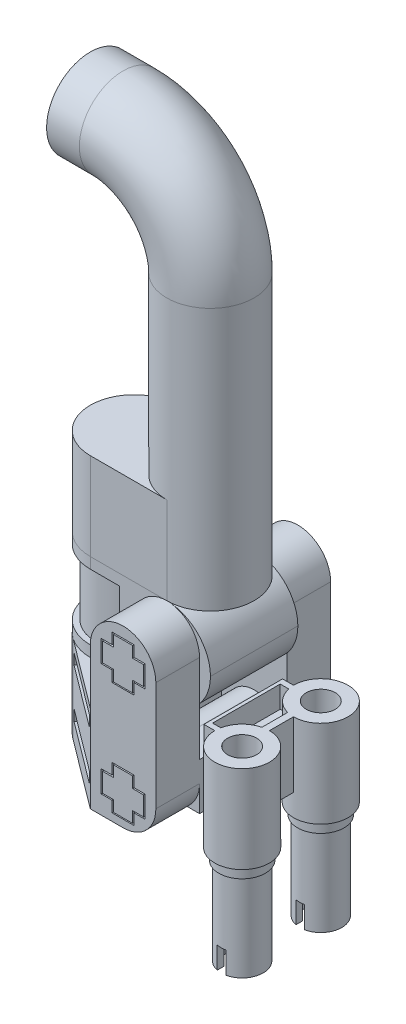
from build123d import *

# Parameters (mm, degrees)
BOSS_EXTRUDE1_DEPTH       = 8
SWEEP1_PROFILE_R          = 4
SKETCH16_R                = 2
BOSS_EXTRUDE2_DEPTH       = 8
FILLET1_R                 = 4
FILLET2_R                 = 4
CUT_EXTRUDE1_START        = -1
SKETCH19_R                = 3.5
CUT_EXTRUDE1_DEPTH        = 6
BOSS_EXTRUDE3_DEPTH       = 8
BOSS_EXTRUDE4_DEPTH       = 4
BOSS_EXTRUDE11_DEPTH      = 4
BOSS_EXTRUDE12_DEPTH      = 4
BOSS_EXTRUDE13_DEPTH      = 4
CUT_EXTRUDE3_DEPTH        = 2
CUT_EXTRUDE6_DEPTH        = 2
BOSS_EXTRUDE14_REACH      = 41.509
SKETCH33_R                = 2.466914626
BOSS_EXTRUDE16_DEPTH      = 8
BOSS_EXTRUDE17_REACH      = 41.446
BOSS_EXTRUDE17_END_RADIUS = 2.466914626
SKETCH35_W                = 8
SKETCH35_H                = 4.287776708
SKETCH36_W                = 1
SKETCH36_H                = 7.2
BOSS_EXTRUDE18_DEPTH      = 6
SKETCH37_R                = 2.499896896
BOSS_EXTRUDE19_DEPTH      = 8
BOSS_EXTRUDE19_2_DEPTH    = 8
BOSS_EXTRUDE20_DEPTH      = 6
CUT_EXTRUDE7_DEPTH        = 2
SKETCH40_R                = 2.123023315
BOSS_EXTRUDE21_DEPTH      = 1
BOSS_EXTRUDE21_2_DEPTH    = 1
SKETCH41_R                = 1.923023315
SKETCH41_R_2              = 1.323023315
BOSS_EXTRUDE22_DEPTH      = 8
BOSS_EXTRUDE22_2_DEPTH    = 8
SKETCH42_R                = 1.323023315
SKETCH42_R_2              = 1.325
CUT_EXTRUDE9_DEPTH        = 18
CUT_EXTRUDE12_DEPTH       = 2
SKETCH47_W                = 6.974811551
SKETCH47_H                = 1
CUT_EXTRUDE15_DEPTH       = 1


with BuildPart() as part:
    # Sketch1 → Boss-Extrude1 (new body)
    with BuildSketch(Plane(origin=(0, 0, 0), x_dir=(1, 0, 0), z_dir=(0, 1, 0))):
        with BuildLine():
            Line((0, -4), (-7, -4))
            ThreePointArc((-7, -4), (-11, 0), (-7, 4))
            Line((-7, 4), (0, 4))
            ThreePointArc((0, 4), (4, 0), (0, -4))
        make_face()
    extrude(amount=BOSS_EXTRUDE1_DEPTH)

    # Sweep1: sweep along a path in Sketch2
    with BuildLine(Plane.XY) as sweep1_path:
        Line((-11, 32), (-8, 32))
        ThreePointArc((-8, 32), (-2.343145751, 29.656854249), (0, 24))
        Line((0, 24), (0, 8))
    # Sweep1 profile (on start of the path) → Sweep1 (sweep)
    with BuildSketch(Plane(origin=(-11, 32, 0), x_dir=(0, 0, 1), z_dir=(1, 0, 0))):
        Circle(SWEEP1_PROFILE_R)
    sweep(path=sweep1_path.line)

    # Cut-Sweep1: sweep along a path in Sketch17
    with BuildLine(Plane.XY) as cut_sweep1_path:
        Line((0, 8), (0, 24))
        Line((0, 24), (0, 24.066611252))
        ThreePointArc((0, 24.066611252), (-2.343145751, 29.723465501), (-8, 32.066611252))
        Line((-8, 32.066611252), (-11, 32.066611252))
    # Sketch16 → Cut-Sweep1 (sweep, cut)
    with BuildSketch(Plane.ZY.offset(11)):
        with Locations((0, 32.066611252)):
            Circle(SKETCH16_R)
    sweep(path=cut_sweep1_path.line, mode=Mode.SUBTRACT)


with BuildPart() as body_2:
    # Sketch18 → Boss-Extrude2 (new body)
    with BuildSketch(Plane.XZ):
        with BuildLine():
            Line((-7, 4), (4, 4))
            Line((4, 4), (4, -4))
            Line((4, -4), (-7, -4))
            ThreePointArc((-7, -4), (-11, 0), (-7, 4))
        make_face()
    extrude(amount=BOSS_EXTRUDE2_DEPTH)

    # Fillet1
    fillet1_edges = [body_2.edges().sort_by_distance(p)[0] for p in [
        (4, -8, 0),
    ]]
    fillet(fillet1_edges, radius=FILLET1_R)

    # Fillet2
    fillet2_edges = [body_2.edges().sort_by_distance(p)[0] for p in [
        (4, 0, 0),
    ]]
    fillet(fillet2_edges, radius=FILLET2_R - 0.0001)  # a hair under: the kernel refuses the full size

    # Sketch19 → Cut-Extrude1 (cut)
    with BuildSketch(Plane.XZ.offset(8).offset(CUT_EXTRUDE1_START)):
        with BuildLine():
            Line((-2.215843823, 0.380707864), (0, 0.380707864))
            Line((0, 0.380707864), (0, -0.661102551))
            Line((0, -0.661102551), (-2.246471603, -0.661102551))
            ThreePointArc((-2.246471603, -0.661102551), (-11.797207417, 0.141031239), (-2.215843823, 0.380707864))
        make_face()
        with Locations(Location((-7, 0, 0), (0, 0, 270))):
            Circle(SKETCH19_R, mode=Mode.SUBTRACT)
    extrude(amount=-CUT_EXTRUDE1_DEPTH, mode=Mode.SUBTRACT)


with BuildPart() as body_3:
    # Sketch20 → Boss-Extrude3 (new body)
    with BuildSketch(Plane.XZ.offset(8)):
        Polygon((-3, 8), (-9.4, 3.2), (-9.4, -3.2), (-3, -8), align=None)
    extrude(amount=BOSS_EXTRUDE3_DEPTH)



with BuildPart() as body_4:
    # Sketch22 → Boss-Extrude4 (new body)
    with BuildSketch(Plane(origin=(0, 0, -4), x_dir=(-1, 0, 0), z_dir=(0, 0, -1))):
        with BuildLine():
            Line((3, -3), (3, -13))
            ThreePointArc((3, -13), (0, -16), (-3, -13))
            Line((-3, -13), (-3, -3))
            ThreePointArc((-3, -3), (0, 0), (3, -3))
        make_face()
    extrude(amount=BOSS_EXTRUDE4_DEPTH)


with BuildPart() as body_5:
    # Sketch23 → Boss-Extrude11 (new body)
    with BuildSketch(Plane.XY.offset(4)):
        with BuildLine():
            Line((3, -3), (3, -13))
            ThreePointArc((3, -13), (0, -16), (-3, -13))
            Line((-3, -13), (-3, -3))
            ThreePointArc((-3, -3), (0, 0), (3, -3))
        make_face()
    extrude(amount=BOSS_EXTRUDE11_DEPTH)


with BuildPart() as body_3_1:
    add(body_3.part)

    add(body_5.part)  # Boss-Extrude12 merges body 5
    # Sketch25 → Boss-Extrude12 (add)
    with BuildSketch(Plane.XY.offset(8)):
        with BuildLine():
            Line((0, -16), (-3, -16))
            Line((-3, -16), (-3, -13))
            ThreePointArc((-3, -13), (-2.121320344, -15.121320344), (0, -16))
        make_face()
    extrude(amount=-BOSS_EXTRUDE12_DEPTH)


    add(body_4.part)  # Boss-Extrude13 merges body 4
    # Sketch26 → Boss-Extrude13 (add)
    with BuildSketch(Plane(origin=(0, 0, -8), x_dir=(-1, 0, 0), z_dir=(0, 0, -1))):
        with BuildLine():
            Line((3, -13), (3, -16))
            Line((3, -16), (0, -16))
            ThreePointArc((0, -16), (2.121320344, -15.121320344), (3, -13))
        make_face()
    extrude(amount=-BOSS_EXTRUDE13_DEPTH)

    # Sketch27 → Cut-Extrude3 (cut)
    # profile 1 of 2: a face of its own
    with BuildSketch(Plane(origin=(0, 0, -8), x_dir=(-1, 0, 0), z_dir=(0, 0, -1))):
        Polygon((-1, -1.5), (1, -1.5), (1, -2.5), (2, -2.5), (2, -4.5), (1, -4.5), (1, -5.5), (-1, -5.5), (-1, -4.5), (-2, -4.5), (-2, -2.5), (-1, -2.5), align=None)
        Polygon((-0.875, -2.63412041), (-1.875, -2.63412041), (-1.875, -4.38412041), (-0.875, -4.38412041), (-0.875, -5.393240821), (0.875, -5.393240821), (0.875, -4.38412041), (1.875, -4.38412041), (1.875, -2.63412041), (0.875, -2.63412041), (0.875, -1.625), (-0.875, -1.625), align=None, mode=Mode.SUBTRACT)
    # profile 2 of 2: a face of its own
    with BuildSketch(Plane(origin=(0, 0, -8), x_dir=(-1, 0, 0), z_dir=(0, 0, -1))):
        Polygon((-1, -11.36450224), (1, -11.36450224), (1, -12.36450224), (2, -12.36450224), (2, -14.36450224), (1, -14.36450224), (1, -15.36450224), (-1, -15.36450224), (-1, -14.36450224), (-2, -14.36450224), (-2, -12.36450224), (-1, -12.36450224), align=None)
        Polygon((-0.875, -12.49862265), (-1.875, -12.49862265), (-1.875, -14.24862265), (-0.875, -14.24862265), (-0.875, -15.25774306), (0.875, -15.25774306), (0.875, -14.24862265), (1.875, -14.24862265), (1.875, -12.49862265), (0.875, -12.49862265), (0.875, -11.48950224), (-0.875, -11.48950224), align=None, mode=Mode.SUBTRACT)
    extrude(amount=-CUT_EXTRUDE3_DEPTH, mode=Mode.SUBTRACT)

    # Sketch30 → Cut-Extrude6 (cut)
    # profile 1 of 2: a face of its own
    with BuildSketch(Plane.XY.offset(8)):
        Polygon((-1, -0.988576671), (1, -0.988576671), (1, -1.988576671), (1.997515412, -1.988576671), (1.997515412, -3.988576671), (1, -3.988576671), (1, -4.988576671), (-1, -4.988576671), (-1, -3.988576671), (-2.002484588, -3.988576671), (-2.002484588, -1.988576671), (-1, -1.988576671), align=None)
        Polygon((-0.875, -2.122698062), (-1.875, -2.122698062), (-1.875, -3.872698062), (-0.875, -3.872698062), (-0.875, -4.881817982), (0.875, -4.881817982), (0.875, -3.872698062), (1.875, -3.872698062), (1.875, -2.122698062), (0.875, -2.122698062), (0.875, -1.113578142), (-0.875, -1.113578142), align=None, mode=Mode.SUBTRACT)
    # profile 2 of 2: a face of its own
    with BuildSketch(Plane.XY.offset(8)):
        Polygon((-1, -11.320301788), (1, -11.320301788), (1, -12.320301788), (2, -12.320301788), (2, -14.320301788), (1, -14.320301788), (1, -15.320301788), (-1, -15.320301788), (-1, -14.320301788), (-2, -14.320301788), (-2, -12.320301788), (-1, -12.320301788), align=None)
        Polygon((-0.875, -12.454422198), (-1.875, -12.454422198), (-1.875, -14.204422198), (-0.875, -14.204422198), (-0.875, -15.213542609), (0.875, -15.213542609), (0.875, -14.204422198), (1.875, -14.204422198), (1.875, -12.454422198), (0.875, -12.454422198), (0.875, -11.445301788), (-0.875, -11.445301788), align=None, mode=Mode.SUBTRACT)
    extrude(amount=-CUT_EXTRUDE6_DEPTH, mode=Mode.SUBTRACT)


with BuildPart() as body_4_2:

    # Sketch33 → Boss-Extrude14 (new, up to next)
    with BuildSketch(Plane(origin=(0, 0, 4), x_dir=(-1, 0, 0), z_dir=(0, 0, -1)), mode=Mode.PRIVATE) as boss_extrude14_sk1:
        with Locations((0, -13.533085374)):
            Circle(SKETCH33_R)
    boss_extrude14_tool1 = extrude(boss_extrude14_sk1.sketch, amount=BOSS_EXTRUDE14_REACH, mode=Mode.PRIVATE) - body_3_1.part
    add(boss_extrude14_tool1.solids().sort_by_distance((0, -13.533085, 4))[0])


with BuildPart() as body_5_2:
    # Sketch34 → Boss-Extrude16 (new body)
    with BuildSketch(Plane.XZ.offset(8)):
        with BuildLine():
            Line((-9.4, 3.2), (-9.4, -3.2))
            ThreePointArc((-9.4, -3.2), (-11, 0), (-9.4, 3.2))
        make_face()
    extrude(amount=BOSS_EXTRUDE16_DEPTH)


with BuildPart() as body_6:
    # Boss-Extrude17: up to this cylinder (the profile starts outside it)
    boss_extrude17_end = Plane(origin=(0, -13.533085374, 0), z_dir=(0, 0, 1)) * Cylinder(BOSS_EXTRUDE17_END_RADIUS, 88.825829251, mode=Mode.PRIVATE)
    # Sketch35 → Boss-Extrude17 (new, up to the surface)
    with BuildSketch(Plane(origin=(3, 0, 0), x_dir=(0, 0, -1), z_dir=(1, 0, 0)), mode=Mode.PRIVATE) as boss_extrude17_sk1:
        with Locations((0, -13.238690847)):
            Rectangle(SKETCH35_W, SKETCH35_H)
    boss_extrude17_tool1 = extrude(boss_extrude17_sk1.sketch, amount=-BOSS_EXTRUDE17_REACH, mode=Mode.PRIVATE) - boss_extrude17_end
    add(boss_extrude17_tool1.solids().sort_by_distance((3, -13.238691, 0))[0])


with BuildPart() as body_3_2:
    add(body_3_1.part)

    add(body_6.part)  # Boss-Extrude18 merges body 6
    # Sketch36 → Boss-Extrude18 (add)
    with BuildSketch(Plane(origin=(0, -8.5, 0), x_dir=(1, 0, 0), z_dir=(0, 1, 0))):
        with Locations((3.5, 0)):
            Rectangle(SKETCH36_W, SKETCH36_H)
    extrude(amount=-BOSS_EXTRUDE18_DEPTH)



with BuildPart() as body_6_2:
    # Sketch37 → Boss-Extrude19 (new body)
    with BuildSketch(Plane(origin=(0, -8.5, 0), x_dir=(1, 0, 0), z_dir=(0, 1, 0))):
        with Locations(Location((6.499896896, 3.6, 0), (0, 0, 270))):
            Circle(SKETCH37_R)
    extrude(amount=-BOSS_EXTRUDE19_DEPTH)


with BuildPart() as body_7:
    # Sketch37 → Boss-Extrude19 2 (new body)
    with BuildSketch(Plane(origin=(0, -8.5, 0), x_dir=(1, 0, 0), z_dir=(0, 1, 0))):
        with Locations(Location((6.499896896, -3.6, 0), (0, 0, 270))):
            Circle(SKETCH37_R)
    extrude(amount=-BOSS_EXTRUDE19_2_DEPTH)


with BuildPart() as body_3_3:
    add(body_3_2.part)

    add(body_6_2.part)  # Boss-Extrude20 merges body 6 2

    add(body_7.part)  # Boss-Extrude20 merges body 7
    # Sketch38 → Boss-Extrude20 (add)
    with BuildSketch(Plane(origin=(0, -8.5, 0), x_dir=(1, 0, 0), z_dir=(0, 1, 0))):
        with BuildLine():
            Line((4, 3.6), (4, -3.6))
            ThreePointArc((4, -3.6), (4.732202849, -1.832305952), (6.499896896, -1.100103104))
            Line((6.499896896, -1.100103104), (6.499896896, 1.100103104))
            ThreePointArc((6.499896896, 1.100103104), (4.732202849, 1.832305952), (4, 3.6))
        make_face()
    extrude(amount=-BOSS_EXTRUDE20_DEPTH)

    # Sketch39 → Cut-Extrude7 (cut)
    with BuildSketch(Plane(origin=(0, -8.5, 0), x_dir=(1, 0, 0), z_dir=(0, 1, 0))):
        with BuildLine():
            Line((3.298541781, 3.089646857), (4.088383893, 3.089646857))
            ThreePointArc((4.088383893, 3.089646857), (4.717152516, 1.876879181), (5.889545476, 1.175701485))
            Line((5.889545476, 1.175701485), (5.889545476, -1.175756688))
            ThreePointArc((5.889545476, -1.175756688), (4.691210487, -1.874271758), (4.049687206, -3.104059515))
            Line((4.049687206, -3.104059515), (3.298541781, -3.104059515))
            Line((3.298541781, -3.104059515), (3.298541781, 3.089646857))
        make_face()
    extrude(amount=-CUT_EXTRUDE7_DEPTH, mode=Mode.SUBTRACT)


with BuildPart() as body_6_3:
    # Sketch40 → Boss-Extrude21 (new body)
    with BuildSketch(Plane.XZ.offset(16.5)):
        with Locations(Location((6.499896896, 3.6, 0), (0, 0, 270))):
            Circle(SKETCH40_R)
    extrude(amount=BOSS_EXTRUDE21_DEPTH)


with BuildPart() as body_7_2:
    # Sketch40 → Boss-Extrude21 2 (new body)
    with BuildSketch(Plane.XZ.offset(16.5)):
        with Locations(Location((6.499896896, -3.6, 0), (0, 0, 270))):
            Circle(SKETCH40_R)
    extrude(amount=BOSS_EXTRUDE21_2_DEPTH)


with BuildPart() as body_8:
    # Sketch41 → Boss-Extrude22 (new body)
    with BuildSketch(Plane.XZ.offset(17.5)):
        with Locations(Location((6.499896896, 3.6, 0), (0, 0, 270))):
            Circle(SKETCH41_R)
        with Locations(Location((6.499896896, 3.6, 0), (0, 0, 270))):
            Circle(SKETCH41_R_2, mode=Mode.SUBTRACT)
    extrude(amount=BOSS_EXTRUDE22_DEPTH)


with BuildPart() as body_9:
    # Sketch41 → Boss-Extrude22 2 (new body)
    with BuildSketch(Plane.XZ.offset(17.5)):
        with Locations(Location((6.499896896, -3.6, 0), (0, 0, 270))):
            Circle(SKETCH41_R)
        with Locations(Location((6.499896896, -3.6, 0), (0, 0, 270))):
            Circle(SKETCH41_R_2, mode=Mode.SUBTRACT)
    extrude(amount=BOSS_EXTRUDE22_2_DEPTH)


with BuildPart() as cut_extrude9_tool:
    # Sketch42 → Cut-Extrude9 (new body)
    with BuildSketch(Plane.XZ.offset(25.5)):
        with Locations(Location((6.499896896, 3.6, 0), (0, 0, 270))):
            Circle(SKETCH42_R)
        with Locations(Location((6.499896896, -3.6, 0), (0, 0, 270))):
            Circle(SKETCH42_R_2)
    extrude(amount=-CUT_EXTRUDE9_DEPTH)


with BuildPart() as body_3_4:
    add(body_3_3.part)

    # Cut-Extrude9: cut by cut_extrude9_tool
    add(cut_extrude9_tool.part, mode=Mode.SUBTRACT)

    # Sketch47 → Cut-Extrude15 (cut)
    with BuildSketch(Plane(origin=(-4.92, 0, -6.56), x_dir=(-0.8000000000000003, 0, 0.5999999999999998), z_dir=(-0.5999999999999998, 0, -0.8000000000000004))):
        with Locations((1.544464356, -9.307185428)):
            Rectangle(SKETCH47_W, SKETCH47_H)
        with Locations((1.544464356, -13.772958012)):
            Rectangle(SKETCH47_W, SKETCH47_H)
    cut_extrude15 = extrude(amount=-CUT_EXTRUDE15_DEPTH, mode=Mode.SUBTRACT)

    # Mirror2: Cut-Extrude15 across plane
    add(cut_extrude15.mirror(Plane.XY), mode=Mode.SUBTRACT)


with BuildPart() as body_6_3_1:
    add(body_6_3.part)

    # Cut-Extrude9: cut by cut_extrude9_tool
    add(cut_extrude9_tool.part, mode=Mode.SUBTRACT)


with BuildPart() as body_7_2_1:
    add(body_7_2.part)

    # Cut-Extrude9: cut by cut_extrude9_tool
    add(cut_extrude9_tool.part, mode=Mode.SUBTRACT)


with BuildPart() as body_9_1:
    add(body_9.part)

    # Cut-Extrude9: cut by cut_extrude9_tool
    add(cut_extrude9_tool.part, mode=Mode.SUBTRACT)


with BuildPart() as cut_extrude12_tool:
    # Sketch44 → Cut-Extrude12 (new body)
    with BuildSketch(Plane.XZ.offset(25.5)):
        with BuildLine():
            Line((6.099896896, 5.600786234), (6.099896896, 1.600786234))
            ThreePointArc((6.099896896, 1.600786234), (6.499896896, 1.559039814), (6.899896896, 1.600786234))
            Line((6.899896896, 1.600786234), (6.899896896, 5.599213766))
            ThreePointArc((6.899896896, 5.599213766), (6.499978953, 5.641746502), (6.099896896, 5.600786234))
        make_face()
        with BuildLine():
            Line((6.099896896, -1.599213766), (6.099896896, -5.599213766))
            ThreePointArc((6.099896896, -5.599213766), (6.499896896, -5.640960186), (6.899896896, -5.599213766))
            Line((6.899896896, -5.599213766), (6.899896896, -1.600786234))
            ThreePointArc((6.899896896, -1.600786234), (6.499978953, -1.558253498), (6.099896896, -1.599213766))
        make_face()
    extrude(amount=-CUT_EXTRUDE12_DEPTH)


with BuildPart() as body_8_1:
    add(body_8.part)

    # Cut-Extrude12: cut by cut_extrude12_tool
    add(cut_extrude12_tool.part, mode=Mode.SUBTRACT)


with BuildPart() as body_9_2:
    add(body_9_1.part)

    # Cut-Extrude12: cut by cut_extrude12_tool
    add(cut_extrude12_tool.part, mode=Mode.SUBTRACT)


solid = Compound([part.part, body_2.part, body_4_2.part, body_5_2.part, body_3_4.part, body_6_3_1.part, body_7_2_1.part, body_8_1.part, body_9_2.part])
